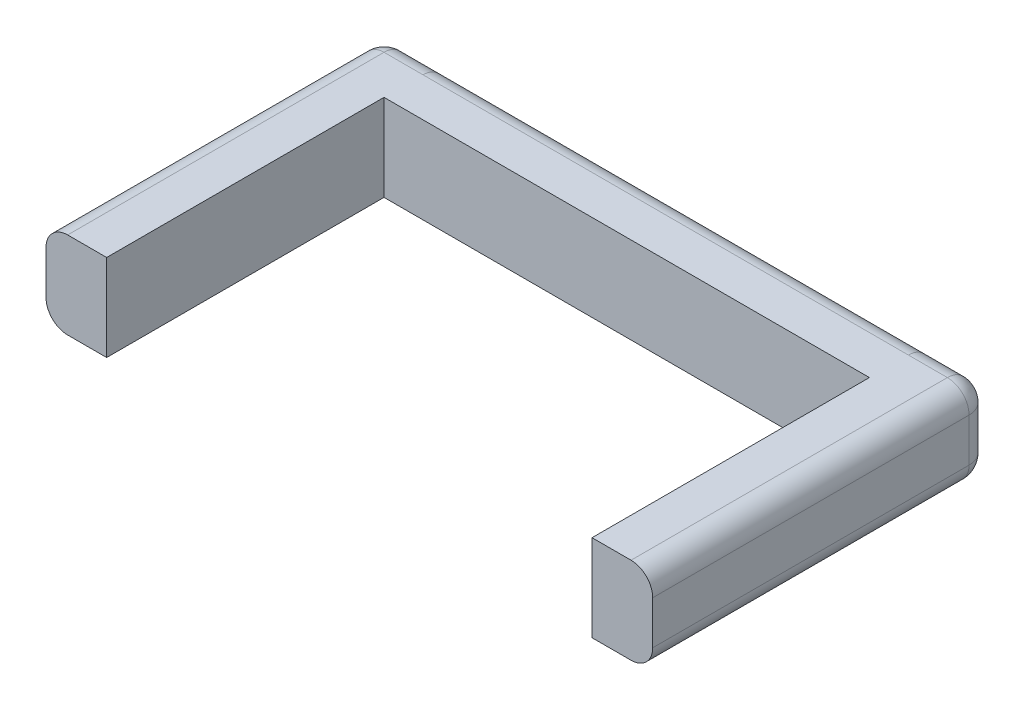
from build123d import *

# Parameters (mm, degrees)
SKETCH1_W           = 88.9
SKETCH1_H           = 127
BOSS_EXTRUDE1_DEPTH = 355.6
FILLET1_R           = 31.75
SKETCH3_W           = 88.9
SKETCH3_H           = 127
BOSS_EXTRUDE2_DEPTH = 495.3
FILLET2_R           = 31.75


# Read off the part's stored shape, not the designer's step: Mirror1
with BuildPart() as part:
    # Sketch1 → Boss-Extrude1 (new, symmetric)
    with BuildSketch(Plane(origin=(0, 0, 0), x_dir=(0, 0, -1), z_dir=(1, 0, 0))):
        Rectangle(SKETCH1_W, SKETCH1_H)
    extrude(amount=BOSS_EXTRUDE1_DEPTH, both=True)

    # Fillet1
    fillet1_edges = [part.edges().sort_by_distance(p)[0] for p in [
        (0, -63.5, -44.45),
        (0, 63.5, -44.45),
    ]]
    fillet(fillet1_edges, radius=FILLET1_R)

    # Sketch3 → Boss-Extrude2 (add)
    with BuildSketch(Plane(origin=(0, 0, -44.45), x_dir=(-1, 0, 0), z_dir=(0, 0, -1))):
        with Locations((400.05, 0)):
            Rectangle(SKETCH3_W, SKETCH3_H)
    extrude(amount=-BOSS_EXTRUDE2_DEPTH)

    # Fillet2
    fillet2_edges = [part.edges().sort_by_distance(p)[0] for p in [
        (-400.05, -63.5, -44.45),
        (-400.05, 63.5, -44.45),
        (-444.5, 0, -44.45),
        (-444.5, -63.5, 203.2),
        (-444.5, 63.5, 203.2),
    ]]
    fillet(fillet2_edges, radius=FILLET2_R)

    # Mirror1: part across plane


with BuildPart() as part_1:
    add(part.part)
    add(part.part.mirror(Plane(origin=(0, 0, 0), x_dir=(0, 0, 1), z_dir=(1, 0, 0))))


solid = part_1.part
